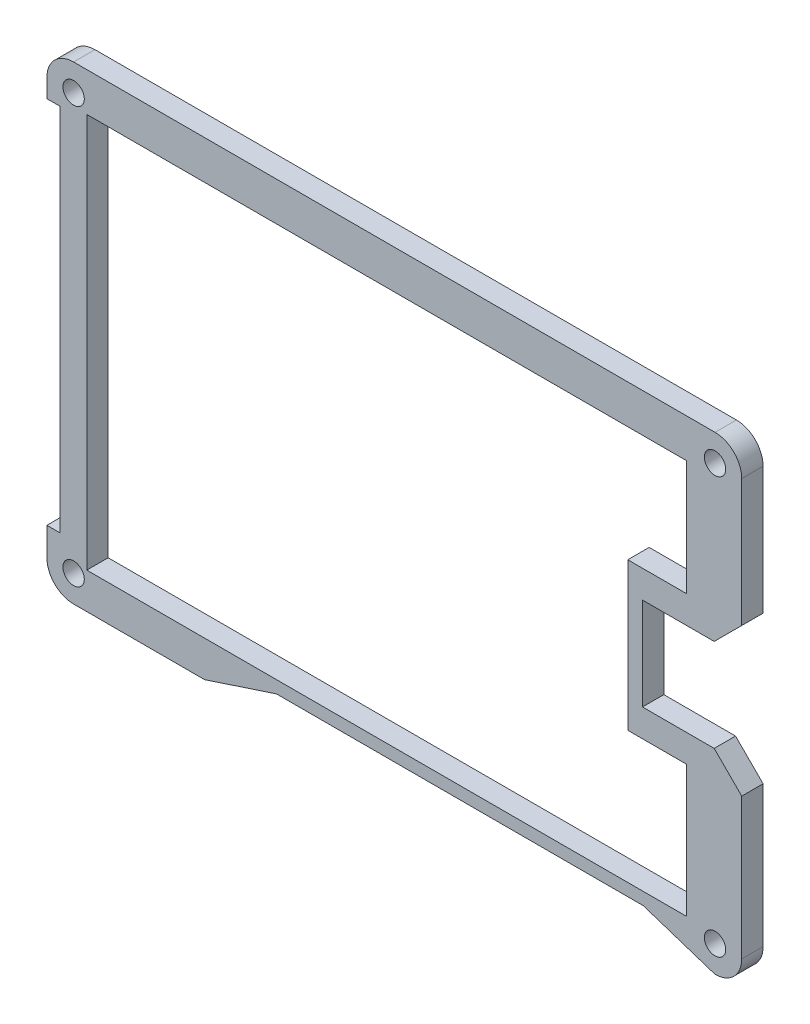
from build123d import *

# Parameters (mm, degrees)
BOSS_EXTRUDE1_DEPTH = 3.048
SKETCH2_R           = 1.355900406
CUT_EXTRUDE1_DEPTH  = 430.898988368
SKETCH3_R           = 1.524
CUT_EXTRUDE2_DEPTH  = 430.898988368


with BuildPart() as part:
    # Sketch1 → Boss-Extrude1 (new body)
    with BuildSketch(Plane.XY):
        with BuildLine():
            Line((-309.8086, 128.8851), (-305.87795, 128.8851))
            Line((-305.87795, 128.8851), (-301.9473, 132.81575))
            Line((-301.9473, 132.81575), (-301.9473, 150.9704))
            ThreePointArc((-301.9473, 150.9704), (-303.063223164, 153.664476836), (-305.7573, 154.7804))
            Line((-305.7573, 154.7804), (-397.247125, 154.7804))
            ThreePointArc((-397.247125, 154.7804), (-399.946077222, 153.659592612), (-401.0571, 150.956597849))
            Line((-401.0571, 150.956597849), (-401.0571, 148.341))
            Line((-401.0571, 148.341), (-399.1521, 148.341))
            Line((-399.1521, 148.341), (-399.1521, 95.6449))
            Line((-399.1521, 95.6449), (-401.0571, 95.6449))
            Line((-401.0571, 95.6449), (-401.0571, 91.659304166))
            ThreePointArc((-401.0571, 91.659304166), (-399.951018769, 88.947400452), (-397.2472, 87.8217))
            Line((-397.2472, 87.8217), (-378.5565, 87.8217))
            Line((-378.5565, 87.8217), (-368.3165, 91.1883))
            Line((-368.3165, 91.1883), (-315.9973, 91.1883))
            Line((-315.9973, 91.1883), (-305.7573, 87.8217))
            ThreePointArc((-305.7573, 87.8217), (-303.063223164, 88.937623164), (-301.9473, 91.6317))
            Line((-301.9473, 91.6317), (-301.9473, 111.74645))
            Line((-301.9473, 111.74645), (-305.87795, 115.6771))
            Line((-305.87795, 115.6771), (-309.8086, 115.6771))
            Line((-309.8086, 115.6771), (-316.1078, 115.6771))
            Line((-316.1078, 115.6771), (-316.1078, 128.8851))
            Line((-316.1078, 128.8851), (-309.8086, 128.8851))
        make_face()
        Polygon((-395.3675, 92.9525), (-395.3675, 149.2432), (-309.8086, 149.2432), (-309.8086, 132.81575), (-318.2033, 132.81575), (-318.2033, 111.74645), (-309.8086, 111.74645), (-309.8086, 92.9525), align=None, mode=Mode.SUBTRACT)
    extrude(amount=BOSS_EXTRUDE1_DEPTH)

    # Sketch2 → Cut-Extrude1 (cut, through all)
    with BuildSketch(Plane(origin=(0, 0, 0), x_dir=(-1, 0, 0), z_dir=(0, 0, -1))):
        with Locations((305.7573, 150.9704)):
            Circle(SKETCH2_R)
        with Locations((397.247125, 150.9704)):
            Circle(SKETCH2_R)
        with Locations((397.2472, 91.6317)):
            Circle(SKETCH2_R)
        with Locations((305.7573, 91.6317)):
            Circle(SKETCH2_R)
    extrude(amount=-CUT_EXTRUDE1_DEPTH, mode=Mode.SUBTRACT)

    # Sketch3 → Cut-Extrude2 (cut, through all)
    with BuildSketch(Plane(origin=(0, 0, 0), x_dir=(-1, 0, 0), z_dir=(0, 0, -1))):
        with Locations((305.7573, 150.9704)):
            Circle(SKETCH3_R)
        with Locations((397.247125, 150.9704)):
            Circle(SKETCH3_R)
        with Locations((397.2472, 91.6317)):
            Circle(SKETCH3_R)
        with Locations((305.7573, 91.6317)):
            Circle(SKETCH3_R)
    extrude(amount=-CUT_EXTRUDE2_DEPTH, mode=Mode.SUBTRACT)


solid = part.part
